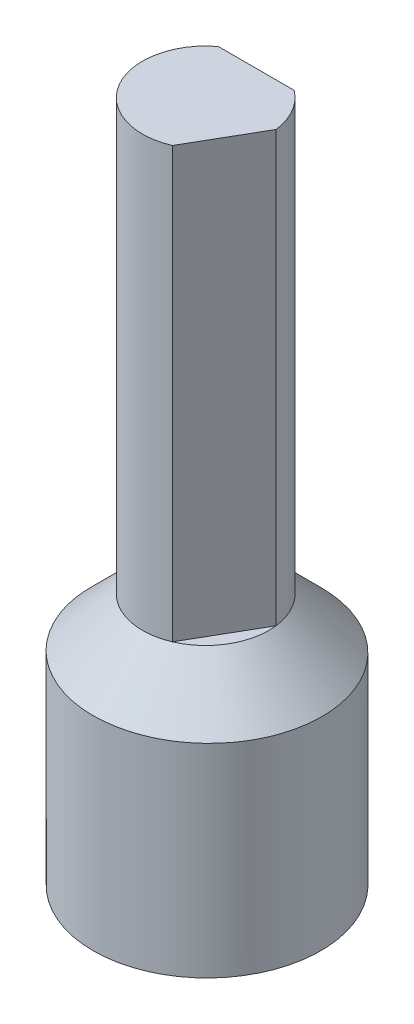
from build123d import *

# Parameters (mm, degrees)
SKETCH1_R           = 9
SKETCH1_W           = 9.1
SKETCH1_H           = 9.1
BOSS_EXTRUDE1_DEPTH = 13
SKETCH2_R           = 9
BOSS_EXTRUDE2_DEPTH = 1
SKETCH3_R           = 5
BOSS_EXTRUDE3_DEPTH = 40
CHAMFER1_SIZE       = 6
SKETCH4_W           = 6
SKETCH4_H           = 4.360376731
CUT_EXTRUDE1_DEPTH  = 34


with BuildPart() as part:
    # Sketch1 → Boss-Extrude1 (new body)
    with BuildSketch(Plane(origin=(0, 0, 0), x_dir=(1, 0, 0), z_dir=(0, 1, 0))):
        with Locations(Location((4.55, 4.55, 0), (0, 0, 90))):
            Circle(SKETCH1_R)
        with Locations((4.55, 4.55)):
            Rectangle(SKETCH1_W, SKETCH1_H, mode=Mode.SUBTRACT)
    extrude(amount=BOSS_EXTRUDE1_DEPTH)

    # Sketch2 → Boss-Extrude2 (add)
    with BuildSketch(Plane(origin=(0, 13, 0), x_dir=(1, 0, 0), z_dir=(0, 1, 0))):
        with Locations(Location((4.55, 4.55, 0), (0, 0, 90))):
            Circle(SKETCH2_R)
    extrude(amount=BOSS_EXTRUDE2_DEPTH)

    # Sketch3 → Boss-Extrude3 (add)
    with BuildSketch(Plane(origin=(0, 14, 0), x_dir=(1, 0, 0), z_dir=(0, 1, 0))):
        with Locations(Location((4.55, 4.443091139, 0), (0, 0, 270))):
            Circle(SKETCH3_R)
    extrude(amount=BOSS_EXTRUDE3_DEPTH)

    # Chamfer1
    # the kernel refuses this chamfer: 6 mm, written as the material it adds along each edge
    with BuildSketch(Plane(origin=(4.55, 14, -4.443091139), x_dir=(0, 0, 1), z_dir=(-1, 0, 0))) as chamfer1_piece_1_section:
        Polygon((5 + CHAMFER1_SIZE, 0), (5, CHAMFER1_SIZE), (5, 0), align=None)
    chamfer1_piece_1 = revolve(axis=Axis((4.55, 14, -4.443091139), (0, 1, 0)), mode=Mode.PRIVATE)
    chamfer1_piece_1 = chamfer1_piece_1 & Plane(origin=(4.55, 17.968075817, -4.55), x_dir=(0, 0, -1), z_dir=(0, -1, 0)) * Cylinder(9, 44, mode=Mode.PRIVATE)
    add(chamfer1_piece_1)

    # Sketch4 → Cut-Extrude1 (cut)
    with BuildSketch(Plane(origin=(0, 54, 0), x_dir=(1, 0, 0), z_dir=(0, 1, 0))):
        Polygon((13.290298635, 2.860978984), (9.514101615, 5.04116735), (6.514101615, -0.154985073), (10.290298635, -2.335173438), align=None)
        with Locations((4.55, 10.623279505)):
            Rectangle(SKETCH4_W, SKETCH4_H)
    extrude(amount=-CUT_EXTRUDE1_DEPTH, mode=Mode.SUBTRACT)


solid = part.part
